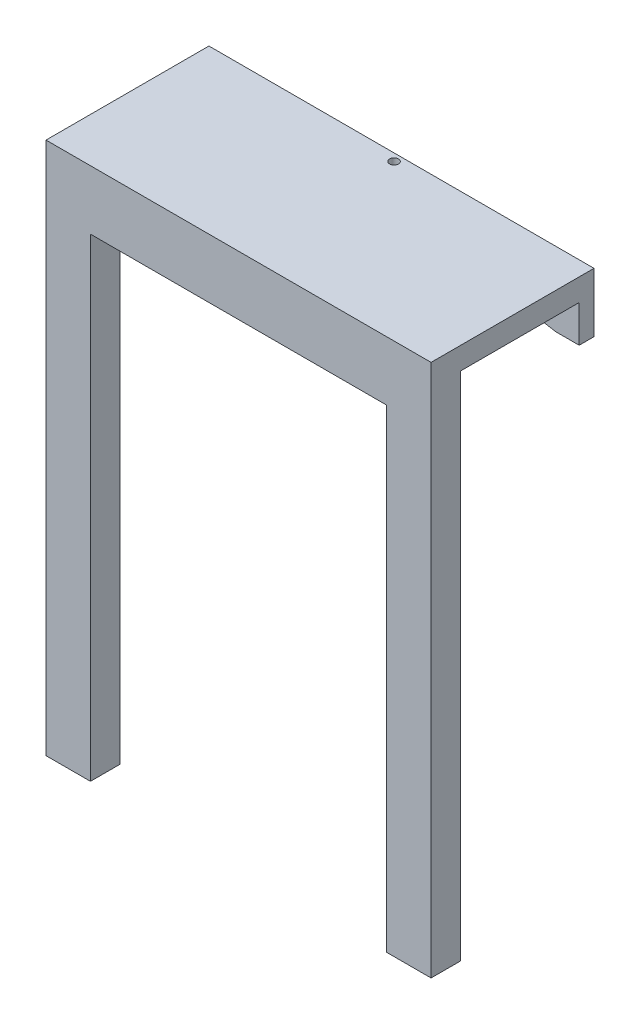
from build123d import *

# Parameters (mm, degrees)
SKETCH1_W           = 165.1
SKETCH1_H           = 228.6
BOSS_EXTRUDE1_DEPTH = 12.7
SKETCH2_W           = 127
SKETCH2_H           = 203.2
CUT_EXTRUDE1_DEPTH  = 142.563704741
SKETCH3_W           = 165.1
SKETCH3_H           = 9.525
BOSS_EXTRUDE2_DEPTH = 57.15
SKETCH4_W           = 19.05
SKETCH4_H           = 15.875
BOSS_EXTRUDE3_DEPTH = 6.35
CUT_EXTRUDE2_REACH  = 159.347
CUT_EXTRUDE3_REACH  = 251.677
SKETCH6_R           = 1.89865


with BuildPart() as part:
    # Sketch1 → Boss-Extrude1 (new body)
    with BuildSketch(Plane.XY):
        Rectangle(SKETCH1_W, SKETCH1_H)
    extrude(amount=BOSS_EXTRUDE1_DEPTH)

    # Sketch2 → Cut-Extrude1 (cut, through all)
    with BuildSketch(Plane.XY.offset(12.7)):
        with Locations((0, -12.7)):
            Rectangle(SKETCH2_W, SKETCH2_H)
    extrude(amount=-CUT_EXTRUDE1_DEPTH, mode=Mode.SUBTRACT)

    # Sketch3 → Boss-Extrude2 (add)
    with BuildSketch(Plane(origin=(0, 0, 0), x_dir=(-1, 0, 0), z_dir=(0, 0, -1))):
        with Locations((0, 109.5375)):
            Rectangle(SKETCH3_W, SKETCH3_H)
    extrude(amount=BOSS_EXTRUDE2_DEPTH)

    # Sketch4 → Boss-Extrude3 (add)
    with BuildSketch(Plane(origin=(0, 0, -57.15), x_dir=(-1, 0, 0), z_dir=(0, 0, -1))):
        with Locations((-73.025, 96.8375)):
            Rectangle(SKETCH4_W, SKETCH4_H)
    boss_extrude3 = extrude(amount=-BOSS_EXTRUDE3_DEPTH)

    # Mirror1: Boss-Extrude3 across plane
    add(boss_extrude3.mirror(Plane(origin=(0, 0, 0), x_dir=(0, 0, 1), z_dir=(1, 0, 0))))

    # Sketch5 → Cut-Extrude2 (cut, up to next)
    with BuildSketch(Plane(origin=(0, 0, -57.15), x_dir=(-1, 0, 0), z_dir=(0, 0, -1)), mode=Mode.PRIVATE) as cut_extrude2_sk1:
        Polygon((-72.503159889, 88.9), (-63.5, 90.4875), (-63.5, 88.9), align=None)
    cut_extrude2_tool1 = extrude(cut_extrude2_sk1.sketch, amount=-CUT_EXTRUDE2_REACH, mode=Mode.PRIVATE) & part.part
    cut_extrude2 = cut_extrude2_tool1.solids().sort_by_distance((66.501053, 89.429167, -57.15))[0]
    add(cut_extrude2, mode=Mode.SUBTRACT)

    # Mirror2: Cut-Extrude2 across plane
    add(cut_extrude2.mirror(Plane(origin=(0, 0, 0), x_dir=(0, 0, 1), z_dir=(1, 0, 0))), mode=Mode.SUBTRACT)

    # Sketch6 → Cut-Extrude3 (cut, up to next)
    with BuildSketch(Plane(origin=(0, 114.3, 0), x_dir=(1, 0, 0), z_dir=(0, 1, 0)), mode=Mode.PRIVATE) as cut_extrude3_sk1:
        with Locations((0, 53.975)):
            Circle(SKETCH6_R)
    cut_extrude3_tool1 = extrude(cut_extrude3_sk1.sketch, amount=-CUT_EXTRUDE3_REACH, mode=Mode.PRIVATE) & part.part
    add(cut_extrude3_tool1.solids().sort_by_distance((0, 114.3, -53.975))[0], mode=Mode.SUBTRACT)


solid = part.part
